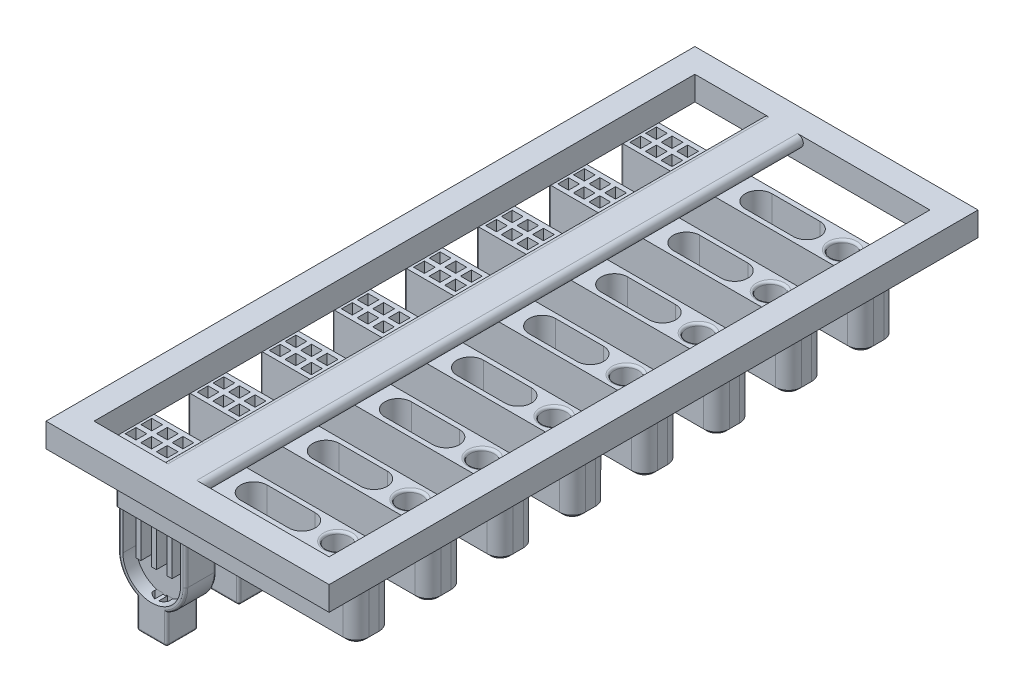
from build123d import *

# Parameters (mm, degrees)
SKETCH1_R                 = 0.5
BOSS_EXTRUDE1_DEPTH       = 2.75
FILLET1_R                 = 0.1
FILLET3_R                 = 0.54
CUT_EXTRUDE3_DEPTH        = 2.75
FILLET4_R                 = 0.1
SKETCH14_3_W              = 0.45
SKETCH14_3_H              = 0.45
CUT_EXTRUDE4_DEPTH        = 10
SKETCH14_W                = 0.2
SKETCH14_H                = 0.2
SKETCH14_H_2              = 0.193588387
SKETCH14_H_3              = 0.45
BOSS_EXTRUDE7_DEPTH       = 1.5
SKETCH17_W                = 2.8
SKETCH17_H                = 0.206411613
BOSS_EXTRUDE11_DEPTH      = 2.7
CUT_EXTRUDE6_DEPTH        = 2.7
BOSS_EXTRUDE12_DEPTH      = 0.65
BOSS_EXTRUDE12_DEPTH_BACK = 0.85
BOSS_EXTRUDE13_DEPTH      = 1.5
CUT_EXTRUDE7_DEPTH        = 0.1
CUT_EXTRUDE8_START        = -0.1
CUT_EXTRUDE8_DEPTH        = 0.1
CUT_EXTRUDE9_DEPTH        = 1.35
CHAMFER3_SIZE             = 0.15
FILLET7_R                 = 0.1
LPATTERN1_COUNT           = 8
LPATTERN1_PITCH           = 3
BOSS_EXTRUDE14_START      = 2.5
SKETCH33_W                = 1
SKETCH33_H                = 1
BOSS_EXTRUDE14_DEPTH      = 27
FILLET10_R                = 0.24
FILLET11_R                = 0.24
SKETCH34_W                = 1
SKETCH34_H                = 1
BOSS_EXTRUDE15_DEPTH      = 10
SKETCH35_W                = 1
SKETCH35_H                = 1
BOSS_EXTRUDE16_DEPTH      = 10


with BuildPart() as part:
    # Sketch1 → Boss-Extrude1 (new body)
    with BuildSketch(Plane(origin=(0, 0, 0), x_dir=(1, 0, 0), z_dir=(0, 1, 0))):
        Polygon((1.5, 0.75), (-2, 0.75), (-8.5, 0.75), (-8.5, -0.75), (-2, -0.75), (1.5, -0.75), align=None)
        with Locations(Location((0, 0, 0), (0, 0, 270))):
            Circle(SKETCH1_R, mode=Mode.SUBTRACT)
    extrude(amount=BOSS_EXTRUDE1_DEPTH)

    # Fillet1
    fillet1_edges = [part.edges().sort_by_distance(p)[0] for p in [
        (0, 2.75, -0.5),
        (0, 0, -0.5),
    ]]
    fillet(fillet1_edges, radius=FILLET1_R)

    # Fillet3
    fillet3_edges = [part.edges().sort_by_distance(p)[0] for p in [
        (1.5, 1.375, -0.75),
        (1.5, 1.375, 0.75),
    ]]
    fillet(fillet3_edges, radius=FILLET3_R)

    # Sketch13 → Cut-Extrude3 (cut)
    with BuildSketch(Plane.XZ):
        with BuildLine():
            Line((-1.5, -0.55), (-3.5, -0.55))
            ThreePointArc((-3.5, -0.55), (-4.05, 0), (-3.5, 0.55))
            Line((-3.5, 0.55), (-1.5, 0.55))
            ThreePointArc((-1.5, 0.55), (-0.95, 0), (-1.5, -0.55))
        make_face()
    extrude(amount=-CUT_EXTRUDE3_DEPTH, mode=Mode.SUBTRACT)

    # Fillet4
    fillet4_edges = [part.edges().sort_by_distance(p)[0] for p in [
        (-0.95, 0, 0),
        (-2.5, 0, 0.55),
        (-4.05, 0, 0),
        (-2.5, 0, -0.55),
    ]]
    fillet(fillet4_edges, radius=FILLET4_R)

    # Sketch14<3> → Cut-Extrude4 (cut)
    with BuildSketch(Plane.XZ):
        with Locations((-8.075, 0.331411613)):
            Rectangle(SKETCH14_3_W, SKETCH14_3_H)
        with Locations((-6.775, 0.331411613)):
            Rectangle(SKETCH14_3_W, SKETCH14_3_H)
        with Locations((-6.775, -0.325)):
            Rectangle(SKETCH14_3_W, SKETCH14_3_H)
        with Locations((-6.125, 0.331411613)):
            Rectangle(SKETCH14_3_W, SKETCH14_3_H)
        with Locations((-8.075, -0.325)):
            Rectangle(SKETCH14_3_W, SKETCH14_3_H)
        with Locations((-7.425, -0.325)):
            Rectangle(SKETCH14_3_W, SKETCH14_3_H)
        with Locations((-7.425, 0.331411613)):
            Rectangle(SKETCH14_3_W, SKETCH14_3_H)
        with Locations((-6.125, -0.325)):
            Rectangle(SKETCH14_3_W, SKETCH14_3_H)
    extrude(amount=-CUT_EXTRUDE4_DEPTH, mode=Mode.SUBTRACT)


with BuildPart() as body_2:
    # Sketch14 → Boss-Extrude7 (new body)
    with BuildSketch(Plane.XZ):
        Polygon((-8.3, -0.55), (-8.3, -0.1), (-8.3, 0.106411613), (-8.3, 0.556411613), (-8.5, 0.556411613), (-8.5, -0.55), align=None)
        Polygon((-8.3, 0.106411613), (-8.3, -0.1), (-7.85, -0.1), (-7.85, -0.55), (-7.65, -0.55), (-7.65, -0.1), (-7.2, -0.1), (-7.2, -0.55), (-7, -0.55), (-7, -0.1), (-6.55, -0.1), (-6.55, -0.55), (-6.35, -0.55), (-6.35, -0.1), (-5.9, -0.1), (-5.9, 0.106411613), (-6.35, 0.106411613), (-6.35, 0.556411613), (-6.55, 0.556411613), (-6.55, 0.106411613), (-7, 0.106411613), (-7, 0.556411613), (-7.2, 0.556411613), (-7.2, 0.106411613), (-7.65, 0.106411613), (-7.65, 0.556411613), (-7.85, 0.556411613), (-7.85, 0.106411613), align=None)
        with Locations((-8.4, -0.65)):
            Rectangle(SKETCH14_W, SKETCH14_H)
        with Locations((-8.4, 0.653205807)):
            Rectangle(SKETCH14_W, SKETCH14_H_2)
        with Locations((-5.8, -0.65)):
            Rectangle(SKETCH14_W, SKETCH14_H)
        with Locations((-5.8, -0.325)):
            Rectangle(SKETCH14_W, SKETCH14_H_3)
        Polygon((-5.9, 0.106411613), (-5.9, -0.1), (-5.7, -0.1), (-5.7, 0.556411613), (-5.9, 0.556411613), align=None)
        with Locations((-5.8, 0.653205807)):
            Rectangle(SKETCH14_W, SKETCH14_H_2)
    extrude(amount=BOSS_EXTRUDE7_DEPTH)


with BuildPart() as part_1:
    add(part.part)

    # Intersect1: read off the stored shape, not the designer's step
    # Intersect1: union body 2
    add(body_2.part)

    # Sketch17 → Boss-Extrude11 (add)
    with BuildSketch(Plane.XZ.offset(1.5)):
        with Locations((-7.1, 0.003205806)):
            Rectangle(SKETCH17_W, SKETCH17_H)
    extrude(amount=BOSS_EXTRUDE11_DEPTH)

    # Sketch19 → Cut-Extrude6 (cut)
    with BuildSketch(Plane(origin=(0, 0, -0.1), x_dir=(-1, 0, 0), z_dir=(0, 0, -1))):
        with BuildLine():
            Line((5.7, -1.5), (5.7, -4.2))
            Line((5.7, -4.2), (8.5, -4.2))
            Line((8.5, -4.2), (8.5, -1.5))
            ThreePointArc((8.5, -1.5), (7.1, -2.9), (5.7, -1.5))
        make_face()
    extrude(amount=-CUT_EXTRUDE6_DEPTH, mode=Mode.SUBTRACT)

    # Sketch22 → Boss-Extrude12 (add, two sides: drawn at the far end of the back side and taken through both)
    with BuildSketch(Plane(origin=(0, 0, -0.1), x_dir=(-1, 0, 0), z_dir=(0, 0, -1)).offset(-BOSS_EXTRUDE12_DEPTH_BACK)):
        with BuildLine():
            Line((8.3, -1.5), (8.5, -1.5))
            ThreePointArc((8.5, -1.5), (7.1, -2.9), (5.7, -1.5))
            Line((5.7, -1.5), (5.9, -1.5))
            ThreePointArc((5.9, -1.5), (7.1, -2.7), (8.3, -1.5))
        make_face()
    extrude(amount=BOSS_EXTRUDE12_DEPTH + BOSS_EXTRUDE12_DEPTH_BACK)

    # 3DSketch1 → Boss-Extrude13 (add)
    with BuildSketch(Plane(origin=(-7.723698689, -4.000792744, 0.75), x_dir=(0.7071067811865476, 0.7071067811865476, 0), z_dir=(0, 0, -1))):
        Polygon((0, 0), (0.882043144, 0.882043144), (1.764086289, 0), (0.882043144, -0.882043144), align=None)
    extrude(amount=BOSS_EXTRUDE13_DEPTH)

    # Sketch25 → Cut-Extrude7 (cut)
    with BuildSketch(Plane.XY.offset(0.75)):
        with BuildLine():
            Line((-8.3, -1.5), (-8.3, 0))
            Line((-8.3, 0), (-8.5, 0))
            Line((-8.5, 0), (-8.5, -1.5))
            ThreePointArc((-8.5, -1.5), (-8.290205479, -2.237164105), (-7.723698689, -2.753395367))
            Line((-7.723698689, -2.753395367), (-7.723698689, -4.000792744))
            Line((-7.723698689, -4.000792744), (-6.476301311, -4.000792744))
            Line((-6.476301311, -4.000792744), (-6.476301311, -2.753395367))
            ThreePointArc((-6.476301311, -2.753395367), (-5.909794521, -2.237164105), (-5.7, -1.5))
            Line((-5.7, -1.5), (-5.7, 0))
            Line((-5.7, 0), (-5.9, 0))
            Line((-5.9, 0), (-5.9, -1.5))
            ThreePointArc((-5.9, -1.5), (-7.1, -2.7), (-8.3, -1.5))
        make_face()
    extrude(amount=-CUT_EXTRUDE7_DEPTH, mode=Mode.SUBTRACT)

    # Sketch29 → Cut-Extrude8 (cut)
    with BuildSketch(Plane(origin=(0, 0, -0.75), x_dir=(-1, 0, 0), z_dir=(0, 0, -1)).offset(CUT_EXTRUDE8_START)):
        with BuildLine():
            Line((8.5, 0), (8.3, 0))
            Line((8.3, 0), (8.3, -1.5))
            ThreePointArc((8.3, -1.5), (7.1, -2.7), (5.9, -1.5))
            Line((5.9, -1.5), (5.9, 0))
            Line((5.9, 0), (5.7, 0))
            Line((5.7, 0), (5.7, -1.5))
            ThreePointArc((5.7, -1.5), (5.909794521, -2.237164105), (6.476301311, -2.753395367))
            Line((6.476301311, -2.753395367), (6.476301311, -4.000792744))
            Line((6.476301311, -4.000792744), (7.723698689, -4.000792744))
            Line((7.723698689, -4.000792744), (7.723698689, -2.753395367))
            ThreePointArc((7.723698689, -2.753395367), (8.290205479, -2.237164105), (8.5, -1.5))
            Line((8.5, -1.5), (8.5, 0))
        make_face()
    extrude(amount=CUT_EXTRUDE8_DEPTH, mode=Mode.SUBTRACT)

    # Sketch23 → Cut-Extrude9 (cut)
    with BuildSketch(Plane.XZ.offset(4.000792744)):
        with BuildLine():
            Line((-7.025, 0.443705984), (-7.025, 0.075))
            Line((-7.025, 0.075), (-6.656294016, 0.075))
            ThreePointArc((-6.656294016, 0.075), (-6.781801948, 0.318198052), (-7.025, 0.443705984))
        make_face()
        with BuildLine():
            Line((-6.656294016, -0.075), (-7.025, -0.075))
            Line((-7.025, -0.075), (-7.025, -0.443705984))
            ThreePointArc((-7.025, -0.443705984), (-6.781801948, -0.318198052), (-6.656294016, -0.075))
        make_face()
        with BuildLine():
            Line((-7.175, -0.075), (-7.543705984, -0.075))
            ThreePointArc((-7.543705984, -0.075), (-7.418198052, -0.318198052), (-7.175, -0.443705984))
            Line((-7.175, -0.443705984), (-7.175, -0.075))
        make_face()
        with BuildLine():
            ThreePointArc((-7.175, 0.443705984), (-7.418198052, 0.318198052), (-7.543705984, 0.075))
            Line((-7.543705984, 0.075), (-7.175, 0.075))
            Line((-7.175, 0.075), (-7.175, 0.443705984))
        make_face()
    extrude(amount=-CUT_EXTRUDE9_DEPTH, mode=Mode.SUBTRACT)

    # Chamfer3
    # the kernel refuses this chamfer: 0.15 mm, written as the material it takes off along each edge
    with BuildSketch(Plane(origin=(0.96, 0, 0.75), x_dir=(0, 0, -1), z_dir=(-1, 0, 0))) as chamfer3_piece_1_section:
        Polygon((CHAMFER3_SIZE, 0), (0, -CHAMFER3_SIZE), (0, 0), align=None)
    chamfer3_piece_1 = extrude(amount=9.845752448, mode=Mode.PRIVATE)
    chamfer3_piece_1 = split(chamfer3_piece_1, bisect_by=Plane(origin=(-5.7, 0, 0.75), z_dir=(1, 0, 0)), keep=Keep.TOP, mode=Mode.PRIVATE)
    add(chamfer3_piece_1, mode=Mode.SUBTRACT)
    with BuildSketch(Plane(origin=(0.96, 0, 0.75), x_dir=(0, 0, -1), z_dir=(-1, 0, 0))) as chamfer3_piece_2_section:
        Polygon((CHAMFER3_SIZE, 0), (0, -CHAMFER3_SIZE), (0, 0), align=None)
    chamfer3_piece_2 = extrude(amount=9.845752448, mode=Mode.PRIVATE)
    chamfer3_piece_2 = split(chamfer3_piece_2, bisect_by=Plane(origin=(0.96, 0, 0.65), z_dir=(0, 0, 1)), keep=Keep.TOP, mode=Mode.PRIVATE)
    add(chamfer3_piece_2, mode=Mode.SUBTRACT)
    with BuildSketch(Plane(origin=(0.96, 0, 0.75), x_dir=(0, 0, -1), z_dir=(-1, 0, 0))) as chamfer3_piece_3_section:
        Polygon((CHAMFER3_SIZE, 0), (0, -CHAMFER3_SIZE), (0, 0), align=None)
    chamfer3_piece_3 = extrude(amount=9.845752448, mode=Mode.PRIVATE)
    chamfer3_piece_3 = split(chamfer3_piece_3, bisect_by=Plane(origin=(-5.9, 0, 0.75), z_dir=(-1, 0, 0)), keep=Keep.TOP, mode=Mode.PRIVATE)
    chamfer3_piece_3 = split(chamfer3_piece_3, bisect_by=Plane(origin=(-8.3, 0, 0.75), z_dir=(1, 0, 0)), keep=Keep.TOP, mode=Mode.PRIVATE)
    add(chamfer3_piece_3, mode=Mode.SUBTRACT)
    with BuildSketch(Plane(origin=(0.96, 0, 0.21), x_dir=(0, 0, 1), z_dir=(-1, 0, 0))) as chamfer3_piece_4:
        Polygon((0.54 - CHAMFER3_SIZE, 0), (0.54, CHAMFER3_SIZE), (0.54, 0), align=None)
    revolve(axis=Axis((0.96, 0, 0.21), (0, 1, 0)), revolution_arc=90, mode=Mode.SUBTRACT)
    with BuildSketch(Plane(origin=(1.5, 0, 0.21), x_dir=(-1, 0, 0), z_dir=(0, 0, -1))) as chamfer3_piece_5:
        Polygon((CHAMFER3_SIZE, 0), (0, CHAMFER3_SIZE), (0, 0), align=None)
    extrude(amount=0.42, mode=Mode.SUBTRACT)
    with BuildSketch(Plane(origin=(0.96, 0, -0.21), x_dir=(0, 0, -1), z_dir=(-1, 0, 0))) as chamfer3_piece_6:
        Polygon((0.54 - CHAMFER3_SIZE, 0), (0.54, -CHAMFER3_SIZE), (0.54, 0), align=None)
    revolve(axis=Axis((0.96, 0, -0.21), (0, -1, 0)), revolution_arc=90, mode=Mode.SUBTRACT)
    with BuildSketch(Plane(origin=(-8.885752448, 0, -0.75), x_dir=(0, 0, 1), z_dir=(1, 0, 0))) as chamfer3_piece_7_section:
        Polygon((CHAMFER3_SIZE, 0), (0, -CHAMFER3_SIZE), (0, 0), align=None)
    chamfer3_piece_7 = extrude(amount=9.845752448, mode=Mode.PRIVATE)
    chamfer3_piece_7 = split(chamfer3_piece_7, bisect_by=Plane(origin=(-8.3, 0, -0.75), z_dir=(1, 0, 0)), keep=Keep.TOP, mode=Mode.PRIVATE)
    chamfer3_piece_7 = split(chamfer3_piece_7, bisect_by=Plane(origin=(-5.9, 0, -0.75), z_dir=(-1, 0, 0)), keep=Keep.TOP, mode=Mode.PRIVATE)
    add(chamfer3_piece_7, mode=Mode.SUBTRACT)
    with BuildSketch(Plane(origin=(-8.885752448, 0, -0.75), x_dir=(0, 0, 1), z_dir=(1, 0, 0))) as chamfer3_piece_8_section:
        Polygon((CHAMFER3_SIZE, 0), (0, -CHAMFER3_SIZE), (0, 0), align=None)
    chamfer3_piece_8 = extrude(amount=9.845752448, mode=Mode.PRIVATE)
    chamfer3_piece_8 = split(chamfer3_piece_8, bisect_by=Plane(origin=(-8.885752448, 0, -0.65), z_dir=(0, 0, -1)), keep=Keep.TOP, mode=Mode.PRIVATE)
    add(chamfer3_piece_8, mode=Mode.SUBTRACT)
    with BuildSketch(Plane(origin=(-8.885752448, 0, -0.75), x_dir=(0, 0, 1), z_dir=(1, 0, 0))) as chamfer3_piece_9_section:
        Polygon((CHAMFER3_SIZE, 0), (0, -CHAMFER3_SIZE), (0, 0), align=None)
    chamfer3_piece_9 = extrude(amount=9.845752448, mode=Mode.PRIVATE)
    chamfer3_piece_9 = split(chamfer3_piece_9, bisect_by=Plane(origin=(-5.7, 0, -0.75), z_dir=(1, 0, 0)), keep=Keep.TOP, mode=Mode.PRIVATE)
    add(chamfer3_piece_9, mode=Mode.SUBTRACT)

    # Fillet7
    fillet7_edges = [part_1.edges().sort_by_distance(p)[0] for p in [
        (-6.476301311, -4.000792744, 0),
        (-7.723698689, -4.000792744, 0),
        (-5.7, -0.725, 0.65),
        (-5.909794521, -2.237164105, 0.65),
        (-6.476301311, -3.377094056, 0.65),
        (-7.1, -4.000792744, 0.65),
        (-7.723698689, -3.377094056, 0.65),
        (-8.290205479, -2.237164105, 0.65),
        (-8.5, -0.725, 0.65),
        (-8.5, -0.725, -0.65),
        (-8.290205479, -2.237164105, -0.65),
        (-7.723698689, -3.377094056, -0.65),
        (-7.1, -4.000792744, -0.65),
        (-6.476301311, -3.377094056, -0.65),
        (-5.909794521, -2.237164105, -0.65),
        (-5.7, -0.725, -0.65),
        (-8.5, 1.45, 0.75),
        (-8.5, 1.45, -0.75),
    ]]
    fillet(fillet7_edges, radius=FILLET7_R - 0.0001)  # a hair under: the kernel refuses the full size


with BuildPart() as lpattern1_1:
    # LPattern1: pattern copy
    add(part_1.part.moved(Location(Vector(0, 0, 1) * (1 * LPATTERN1_PITCH))))


with BuildPart() as lpattern1_2:
    # LPattern1: pattern copy
    add(part_1.part.moved(Location(Vector(0, 0, 1) * (2 * LPATTERN1_PITCH))))


with BuildPart() as lpattern1_3:
    # LPattern1: pattern copy
    add(part_1.part.moved(Location(Vector(0, 0, 1) * (3 * LPATTERN1_PITCH))))


with BuildPart() as lpattern1_4:
    # LPattern1: pattern copy
    add(part_1.part.moved(Location(Vector(0, 0, 1) * (4 * LPATTERN1_PITCH))))


with BuildPart() as lpattern1_5:
    # LPattern1: pattern copy
    add(part_1.part.moved(Location(Vector(0, 0, 1) * (5 * LPATTERN1_PITCH))))


with BuildPart() as lpattern1_6:
    # LPattern1: pattern copy
    add(part_1.part.moved(Location(Vector(0, 0, 1) * (6 * LPATTERN1_PITCH))))


with BuildPart() as lpattern1_7:
    # LPattern1: pattern copy
    add(part_1.part.moved(Location(Vector(0, 0, 1) * (7 * LPATTERN1_PITCH))))


with BuildPart() as part_2:
    add(part_1.part)

    add(lpattern1_1.part)  # Boss-Extrude14 merges LPattern1_1

    add(lpattern1_2.part)  # Boss-Extrude14 merges LPattern1_2

    add(lpattern1_3.part)  # Boss-Extrude14 merges LPattern1_3

    add(lpattern1_4.part)  # Boss-Extrude14 merges LPattern1_4

    add(lpattern1_5.part)  # Boss-Extrude14 merges LPattern1_5

    add(lpattern1_6.part)  # Boss-Extrude14 merges LPattern1_6

    add(lpattern1_7.part)  # Boss-Extrude14 merges LPattern1_7
    # Sketch33 → Boss-Extrude14 (add)
    with BuildSketch(Plane(origin=(0, 0, -0.75), x_dir=(-1, 0, 0), z_dir=(0, 0, -1)).offset(BOSS_EXTRUDE14_START)):
        with Locations((-1.88, 3.25)):
            Rectangle(SKETCH33_W, SKETCH33_H)
        Polygon((4.55, 2.75), (3.55, 3.75), (5.9, 3.75), (4.9, 2.75), align=None)
        with Locations((8.9, 3.25)):
            Rectangle(SKETCH33_W, SKETCH33_H)
    extrude(amount=-BOSS_EXTRUDE14_DEPTH)

    # Fillet10
    fillet10_edges = [part_2.edges().sort_by_distance(p)[0] for p in [
        (-3.55, 3.75, 10.25),
    ]]
    fillet(fillet10_edges, radius=FILLET10_R)

    # Fillet11
    fillet11_edges = [part_2.edges().sort_by_distance(p)[0] for p in [
        (-5.9, 3.75, 10.25),
    ]]
    fillet(fillet11_edges, radius=FILLET11_R)

    # Sketch34 → Boss-Extrude15 (add)
    with BuildSketch(Plane(origin=(-8.4, 0, 0), x_dir=(0, 0, -1), z_dir=(1, 0, 0))):
        with Locations((2.75, 3.25)):
            Rectangle(SKETCH34_W, SKETCH34_H)
    extrude(amount=BOSS_EXTRUDE15_DEPTH)

    # Sketch35 → Boss-Extrude16 (add)
    with BuildSketch(Plane(origin=(-8.4, 0, 0), x_dir=(0, 0, -1), z_dir=(1, 0, 0))):
        with Locations((-23.25, 3.25)):
            Rectangle(SKETCH35_W, SKETCH35_H)
    extrude(amount=BOSS_EXTRUDE16_DEPTH)


solid = part_2.part
